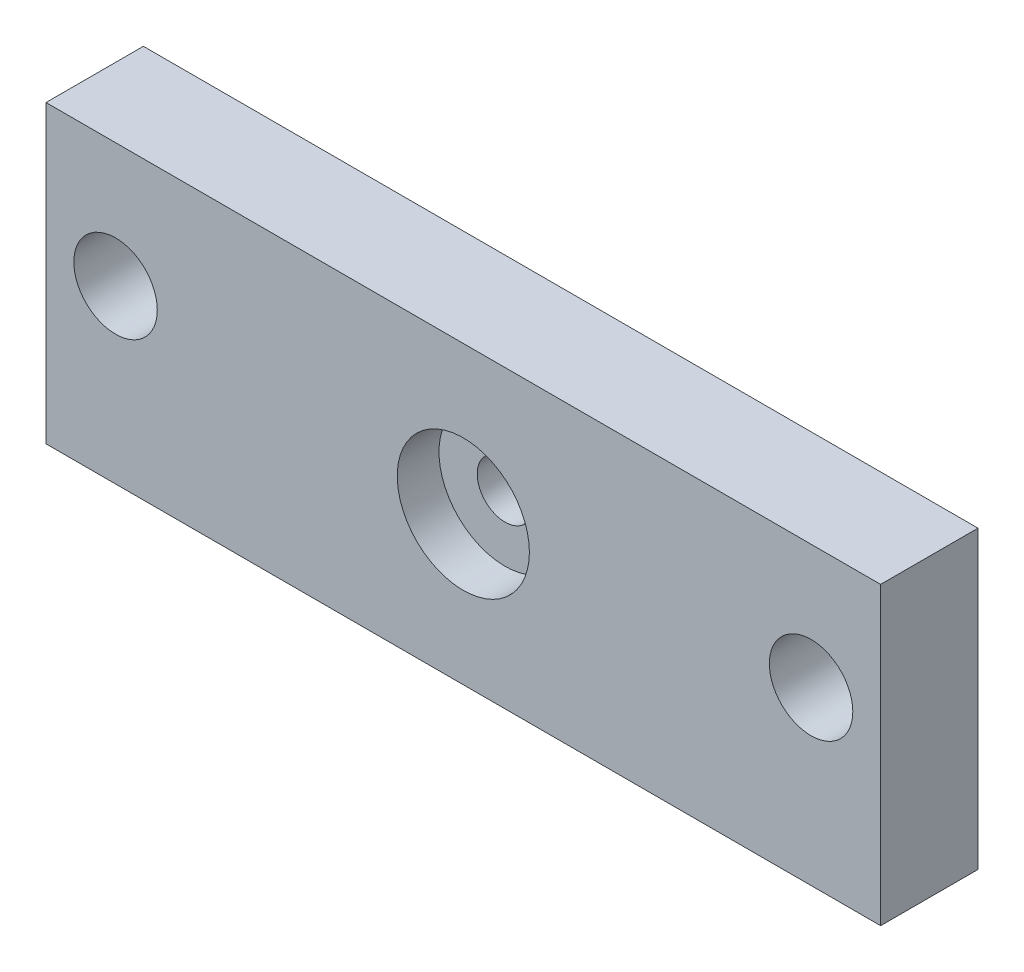
from build123d import *

# Parameters (mm, degrees)
SKETCH1_W           = 120
SKETCH1_H           = 42.5
BOSS_EXTRUDE1_DEPTH = 7
SKETCH2_R           = 9.5
CUT_EXTRUDE1_DEPTH  = 6
SKETCH3_R           = 4
CUT_EXTRUDE2_DEPTH  = 65.152649984
SKETCH5_R           = 6
CUT_EXTRUDE4_DEPTH  = 66.173326599
SKETCH6_R           = 2.1
SKETCH6_R_2         = 1.25
CUT_EXTRUDE5_DEPTH  = 10


with BuildPart() as part:
    # Sketch1 → Boss-Extrude1 (new, symmetric)
    with BuildSketch(Plane.XY):
        Rectangle(SKETCH1_W, SKETCH1_H)
    extrude(amount=BOSS_EXTRUDE1_DEPTH, both=True)

    # Sketch2 → Cut-Extrude1 (cut)
    with BuildSketch(Plane.XY.offset(7)):
        Circle(SKETCH2_R)
    extrude(amount=-CUT_EXTRUDE1_DEPTH, mode=Mode.SUBTRACT)

    # Sketch3 → Cut-Extrude2 (cut, through all)
    with BuildSketch(Plane.XY.offset(1)):
        Circle(SKETCH3_R)
    extrude(amount=-CUT_EXTRUDE2_DEPTH, mode=Mode.SUBTRACT)

    # Sketch5 → Cut-Extrude4 (cut, through all)
    with BuildSketch(Plane.XY.offset(7)):
        with Locations((-50, 3.4)):
            Circle(SKETCH5_R)
        with Locations((50, 3.4)):
            Circle(SKETCH5_R)
    extrude(amount=-CUT_EXTRUDE4_DEPTH, mode=Mode.SUBTRACT)

    # Sketch6 → Cut-Extrude5 (cut)
    with BuildSketch(Plane.XZ.offset(21.25)):
        with Locations((-50, 0)):
            Circle(SKETCH6_R)
        with Locations((-25, 0)):
            Circle(SKETCH6_R)
        with Locations((25, 0)):
            Circle(SKETCH6_R)
        with Locations((50, 0)):
            Circle(SKETCH6_R)
        with Locations((-37.5, 0)):
            Circle(SKETCH6_R_2)
        with Locations((37.5, 0)):
            Circle(SKETCH6_R_2)
    extrude(amount=-CUT_EXTRUDE5_DEPTH, mode=Mode.SUBTRACT)


solid = part.part
